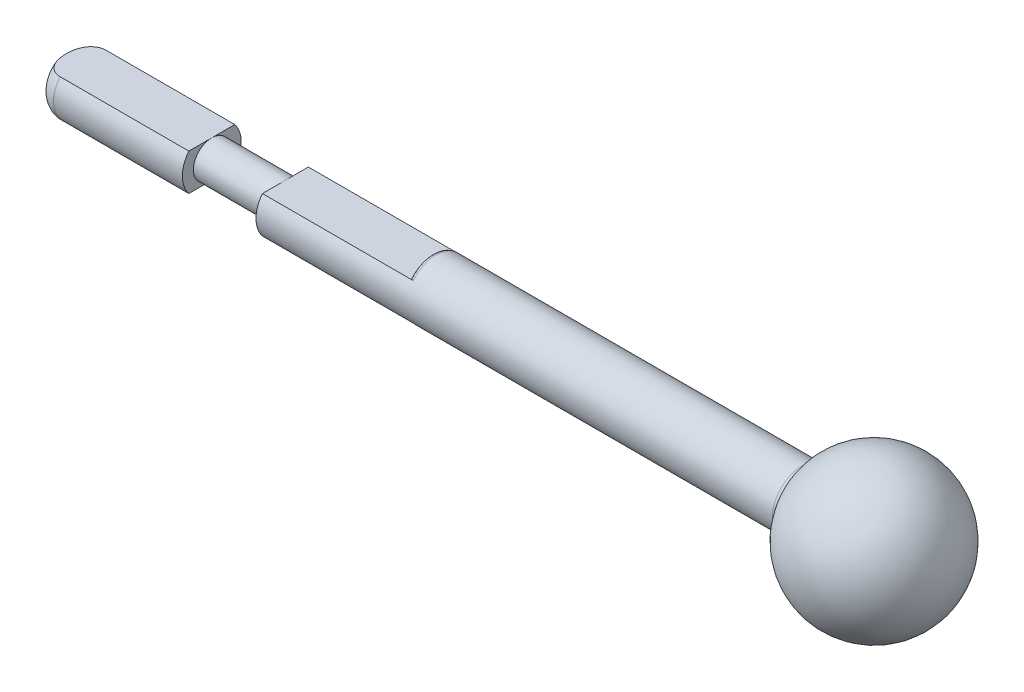
from build123d import *

# Parameters (mm, degrees)
CUT_EXTRUDE1_START = -10
CUT_EXTRUDE1_DEPTH = 10
FILLET3_R          = 0.2
FILLET3_R_2        = 0.5
FILLET3_R_3        = 0.1


with BuildPart() as part:
    # Sketch1 → Revolve1 (revolve)
    with BuildSketch(Plane.XY, mode=Mode.PRIVATE) as revolve1_sk:
        with BuildLine():
            Line((0, 0.8000000000000004), (2, 0.7999999999999999))
            Line((2, 0.7999999999999999), (2, 0.5))
            Line((2, 0.5), (4, 0.5))
            Line((4, 0.5), (4, 0.7999999999999999))
            Line((4, 0.7999999999999999), (18.166969722017665, 0.7999999999999999))
            ThreePointArc((18.166969722017665, 0.7999999999999999), (20.40861928737844, 1.9578126258614066), (22, 0))
            Line((22, 0), (0, 0))
            Line((0, 0), (-2, 0))
            Line((-2, 0), (-2, 0.7999999999999998))
            Line((-2, 0.7999999999999998), (0, 0.8000000000000004))
        make_face()
    revolve(revolve1_sk.sketch.rotate(Axis((0, 0, 0), (1, 0, 0)), 90), axis=Axis((0, 0, 0), (1, 0, 0)))

    # Sketch2 → Cut-Extrude1 (cut)
    with BuildSketch(Plane.ZY.offset(2).offset(CUT_EXTRUDE1_START)):
        with BuildLine():
            Line((0.6244997998398396, -0.5), (-0.6244997998398398, -0.5))
            ThreePointArc((-0.6244997998398398, -0.5), (-1.3e-16, -0.7999999999999998), (0.6244997998398396, -0.5))
        make_face()
        with BuildLine():
            Line((0.6244997998398396, 0.5), (-0.6244997998398398, 0.5))
            ThreePointArc((-0.6244997998398398, 0.5), (-1.3e-16, 0.7999999999999998), (0.6244997998398396, 0.5))
        make_face()
    extrude(amount=CUT_EXTRUDE1_DEPTH, mode=Mode.SUBTRACT)

    # Fillet3
    # the kernel refuses this fillet: 0.5, 0.2, 0.1 mm, written as the material it adds along each edge
    with BuildSketch(Plane(origin=(18.166969722017665, 0, 0), x_dir=(0, 1.1e-16, 1), z_dir=(0, 1, -1.1e-16))) as fillet3_piece_1:
        with BuildLine():
            CenterArc((0.9999999999999997, -0.1265615162442053), FILLET3_R, 117.03569178941255, 62.96430821058948)
            Line((0.7999999999999996, -0.1265615162442124), (0.8, 0))
            ThreePointArc((0.8, 0), (0.8549345824779961, 0.02496864748320604), (0.9090909090909083, 0.05158319232184283))
        make_face()
    revolve(axis=Axis((18.166969722017665, 0, 0), (1, 0, 0)))
    # the kernel refuses this fillet: 0.5, 0.2, 0.1 mm, written as the material it takes off along each edge
    with BuildSketch(Plane(origin=(-2, 0, 0), x_dir=(0, 0.7854961071297899, -0.6188665976476235), z_dir=(0, -0.6188665976476235, -0.7854961071297899))) as fillet3_2_piece_1:
        with BuildLine():
            CenterArc((0.7999999999999998 - FILLET3_R_2, FILLET3_R_2), FILLET3_R_2, 270, 90)
            Line((0.7999999999999998 - FILLET3_R_2, 0), (0.7999999999999998, 0))
            Line((0.7999999999999998, 0), (0.7999999999999998, FILLET3_R_2))
        make_face()
    revolve(axis=Axis((-2, 0, 0), (1, 0, 0)), revolution_arc=256.4668291762195, mode=Mode.SUBTRACT)
    with BuildSketch(Plane(origin=(-2, 0, 0), x_dir=(0, -0.7854961071297903, 0.6188665976476231), z_dir=(0, 0.6188665976476231, 0.7854961071297903))) as fillet3_2_piece_2:
        with BuildLine():
            CenterArc((0.7999999999999998 - FILLET3_R_2, FILLET3_R_2), FILLET3_R_2, 270, 90)
            Line((0.7999999999999998 - FILLET3_R_2, 0), (0.7999999999999998, 0))
            Line((0.7999999999999998, 0), (0.7999999999999998, FILLET3_R_2))
        make_face()
    revolve(axis=Axis((-2, 0, 0), (1, 0, 0)), revolution_arc=256.46682917621945, mode=Mode.SUBTRACT)
    with BuildSketch(Plane(origin=(8, 6.7e-16, -1.1e-16), x_dir=(0, -0.35458319650881664, -0.9350244685320219), z_dir=(0, 0.9350244685320219, -0.35458319650881664))) as fillet3_2_piece_3_section:
        with BuildLine():
            CenterArc((0.8000000000000002 - FILLET3_R_3, -FILLET3_R_3), FILLET3_R_3, 0, 90)
            Line((0.8000000000000002 - FILLET3_R_3, 0), (0.8000000000000002, 0))
            Line((0.8000000000000002, 0), (0.8000000000000002, -FILLET3_R_3))
        make_face()
    fillet3_2_piece_3 = revolve(axis=Axis((8, 6.7e-16, -1.1e-16), (-1, 0, 0)), revolution_arc=138.4641967481308, mode=Mode.PRIVATE)
    fillet3_2_piece_3 = split(fillet3_2_piece_3, bisect_by=Plane(origin=(8.02822018538669, -0.5, -2.2e-16), z_dir=(0, -1, 0)), keep=Keep.TOP, mode=Mode.PRIVATE)
    add(fillet3_2_piece_3, mode=Mode.SUBTRACT)
    with BuildSketch(Plane(origin=(8, -6.7e-16, -1.1e-16), x_dir=(0, 0.35458319650881664, -0.9350244685320219), z_dir=(0, -0.9350244685320219, -0.35458319650881664))) as fillet3_2_piece_4_section:
        with BuildLine():
            CenterArc((0.8 - FILLET3_R_3, FILLET3_R_3), FILLET3_R_3, 270, 90)
            Line((0.8 - FILLET3_R_3, 0), (0.8, 0))
            Line((0.8, 0), (0.8, FILLET3_R_3))
        make_face()
    fillet3_2_piece_4 = revolve(axis=Axis((8, -6.7e-16, -1.1e-16), (1, 0, 0)), revolution_arc=138.4641967481308, mode=Mode.PRIVATE)
    fillet3_2_piece_4 = split(fillet3_2_piece_4, bisect_by=Plane(origin=(8.02822018538669, 0.5, -2.2e-16), z_dir=(0, 1, 0)), keep=Keep.TOP, mode=Mode.PRIVATE)
    add(fillet3_2_piece_4, mode=Mode.SUBTRACT)


solid = part.part
